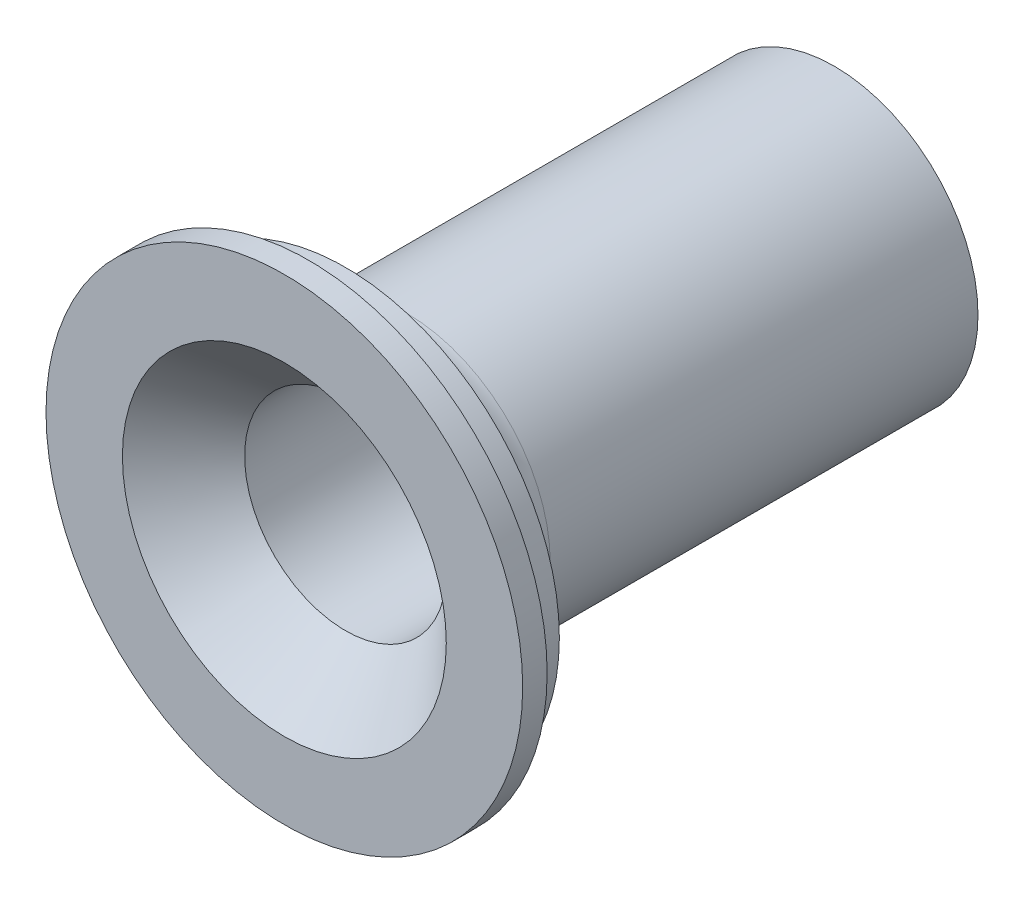
from build123d import *

# Parameters (mm, degrees)
SZKIC2_R                    = 2
DODANIE_WYCI_GNI_CIE1_DEPTH = 1


with BuildPart() as part:
    # Szkic1 → Obrót1 (revolve)
    with BuildSketch(Plane(origin=(0, 0, 0), x_dir=(1, 0, 0), z_dir=(0, 1, 0))):
        with BuildLine():
            Line((8.25, 5), (13.25, 0))
            Line((13.25, 0), (19.5, 0))
            Line((19.5, 0), (19.5, 2))
            Line((19.5, 2), (17.5, 2))
            Line((17.5, 2), (17.5, 5))
            Line((17.5, 5), (16.75, 5))
            ThreePointArc((16.75, 5), (13.214466094, 6.464466094), (11.75, 10))
            Line((11.75, 10), (11.75, 45))
            Line((11.75, 45), (2, 45))
            Line((2, 45), (2, 38))
            Line((2, 38), (5.25, 38))
            ThreePointArc((5.25, 38), (7.371320344, 37.121320344), (8.25, 35))
            Line((8.25, 35), (8.25, 5))
        make_face()
    revolve(axis=Axis((0, 0, 0), (0, 0, -1)))

    # Szkic2 → Dodanie-wyciągnięcie1 (add)
    with BuildSketch(Plane(origin=(0, 0, -45), x_dir=(-1, 0, 0), z_dir=(0, 0, -1))):
        Polygon((0, -8.082903769), (7, -4.041451884), (7, 4.041451884), (0, 8.082903769), (-7, 4.041451884), (-7, -4.041451884), align=None)
        Circle(SZKIC2_R, mode=Mode.SUBTRACT)
    extrude(amount=DODANIE_WYCI_GNI_CIE1_DEPTH)


solid = part.part
